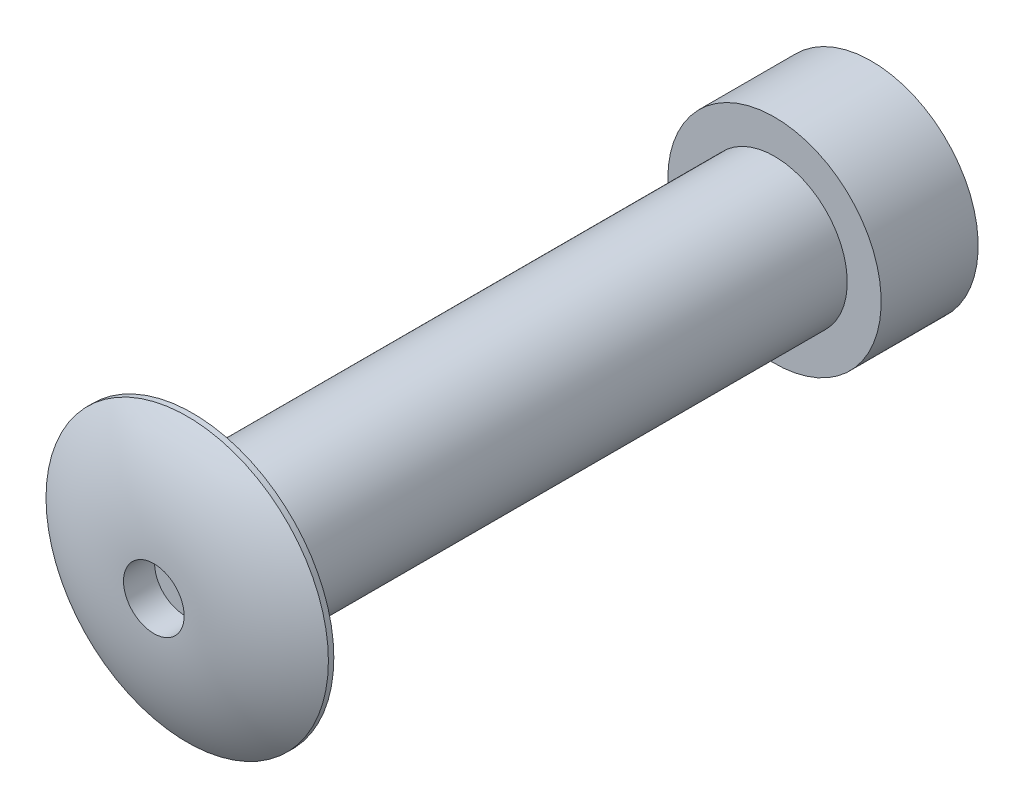
from build123d import *

# Parameters (mm, degrees)
SKETCH4_R          = 0.9921875
CUT_EXTRUDE1_DEPTH = 1.016
CUT_EXTRUDE2_START = -2.54
SKETCH3_R          = 0.9921875
CUT_EXTRUDE2_DEPTH = 2.54


with BuildPart() as part:
    # Sketch2 → Revolve1 (revolve)
    with BuildSketch(Plane(origin=(0, 0, 0), x_dir=(0, 0, -1), z_dir=(1, 0, 0))):
        with BuildLine():
            Line((-1.27, 0.9921875), (-1.27, 0))
            Line((-1.27, 0), (19.05, 0))
            Line((19.05, 0), (22.225, 0))
            Line((22.225, 0), (22.225, 3.4925))
            Line((22.225, 3.4925), (19.05, 3.4925))
            Line((19.05, 3.4925), (19.05, 2.38125))
            Line((19.05, 2.38125), (0, 2.38125))
            Line((0, 2.38125), (0, 4.6228))
            Line((0, 4.6228), (-0.1778, 4.6228))
            ThreePointArc((-0.1778, 4.6228), (-0.991036966, 2.887856773), (-1.27, 0.9921875))
        make_face()
    revolve(axis=Axis((0, 0, 7.600580616), (0, 0, 1)))

    # Sketch4 → Cut-Extrude1 (cut)
    with BuildSketch(Plane.XY.offset(1.27)):
        Circle(SKETCH4_R)
    extrude(amount=-CUT_EXTRUDE1_DEPTH, mode=Mode.SUBTRACT)

    # Sketch3 → Cut-Extrude2 (cut)
    with BuildSketch(Plane(origin=(0, 0, -22.225), x_dir=(-1, 0, 0), z_dir=(0, 0, -1)).offset(CUT_EXTRUDE2_START)):
        Circle(SKETCH3_R)
    extrude(amount=CUT_EXTRUDE2_DEPTH, mode=Mode.SUBTRACT)


solid = part.part
